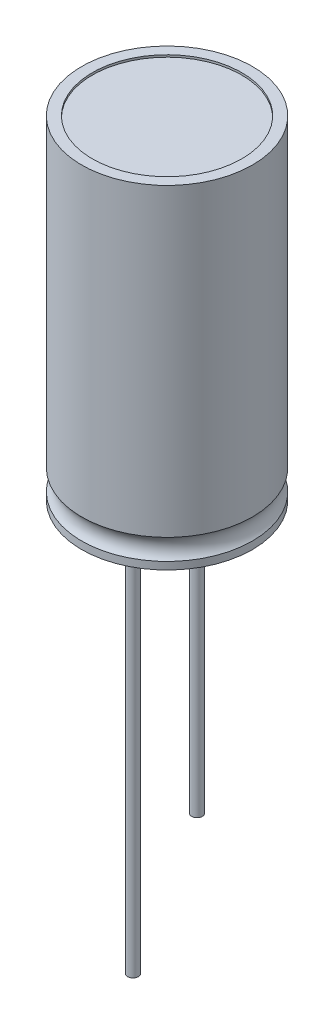
from build123d import *

# Parameters (mm, degrees)
SKETCH_2_R        = 0.25
EXTRUDE_1_DEPTH   = 20
OTHER_START       = -19.9
OTHER_1_OUTLINE_R = 0.25
OTHER_1_DEPTH     = 8


# Read off the part's stored shape, not the designer's step: 连接点1
with BuildPart() as part:
    # 草图1 → 旋转1 (revolve)
    with BuildSketch(Plane.XY):
        with BuildLine():
            Line((3.5, 0.1), (3.5, 0))
            Line((3.5, 0), (4, 0))
            Line((4, 0), (4, 0.349678286))
            ThreePointArc((4, 0.349678286), (3.798136614, 0.837019609), (4, 1.324360933))
            Line((4, 1.324360933), (4, 15.6))
            Line((4, 15.6), (3.5, 15.6))
            Line((3.5, 15.6), (3.5, 15.5))
            Line((3.5, 15.5), (0, 15.5))
            Line((0, 15.5), (0, 0.1))
            Line((0, 0.1), (3.5, 0.1))
        make_face()
    revolve(axis=Axis((0, 0, 0), (0, 1, 0)))

    # 草图2 → 凸台-拉伸1 (add)
    with BuildSketch(Plane.XZ.offset(-0.1)):
        with Locations((-1.5, 0.094730426)):
            Circle(SKETCH_2_R)
        with Locations((1.5, 0.094730426)):
            Circle(SKETCH_2_R)
    extrude(amount=EXTRUDE_1_DEPTH)

    # 连接点1 outline → 连接点1 (cut)
    with BuildSketch(Plane(origin=(0, 0, 0), x_dir=(1, 0, 0), z_dir=(0, 1, 0)).offset(OTHER_START)):
        with Locations((1.5, -0.094730426)):
            Circle(OTHER_1_OUTLINE_R)
    extrude(amount=OTHER_1_DEPTH, mode=Mode.SUBTRACT)


solid = part.part
